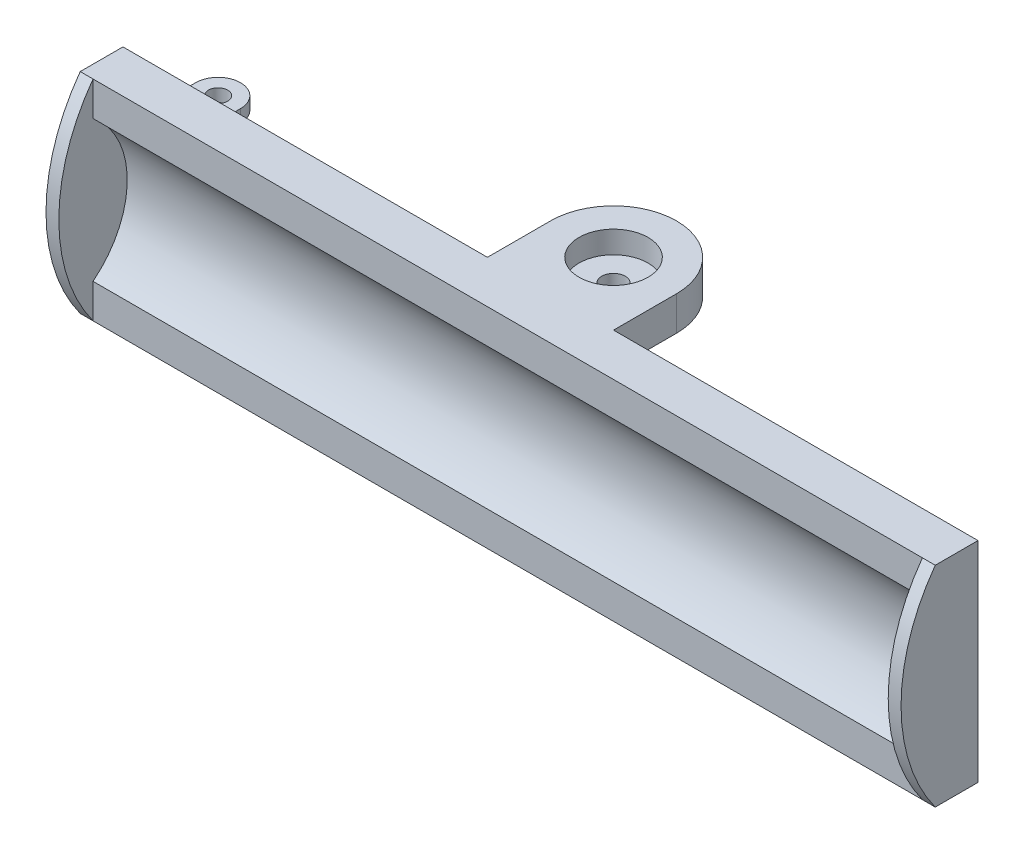
from build123d import *

# Parameters (mm, degrees)
BOSS_EXTRUDE1_DEPTH = 100
SKETCH3_R           = 2.75
BOSS_EXTRUDE2_DEPTH = 8
SKETCH4_R           = 8.075
CUT_EXTRUDE1_DEPTH  = 5.2
BOSS_EXTRUDE5_START = 8
BOSS_EXTRUDE5_DEPTH = 3
BOSS_EXTRUDE6_DEPTH = 3


with BuildPart() as part:
    # Sketch1 → Boss-Extrude1 (new, symmetric)
    with BuildSketch(Plane.YZ):
        with BuildLine():
            Line((-24.5, 5), (-24.5, -5))
            Line((-24.5, -5), (24.5, -5))
            Line((24.5, -5), (24.5, 5))
            Line((24.5, 5), (16.492422502, 5))
            ThreePointArc((16.492422502, 5), (0, -3), (-16.492422502, 5))
            Line((-16.492422502, 5), (-24.5, 5))
        make_face()
    extrude(amount=BOSS_EXTRUDE1_DEPTH, both=True)

    # Sketch3 → Boss-Extrude2 (add)
    with BuildSketch(Plane.XZ.offset(24.5)):
        with BuildLine():
            ThreePointArc((-14.75, -19.75), (0, -34.5), (14.75, -19.75))
            Line((14.75, -19.75), (14.75, -5))
            Line((14.75, -5), (-14.75, -5))
            Line((-14.75, -5), (-14.75, -19.75))
        make_face()
        with Locations((0, -19.75)):
            Circle(SKETCH3_R, mode=Mode.SUBTRACT)
    boss_extrude2 = extrude(amount=-BOSS_EXTRUDE2_DEPTH)

    # Sketch4 → Cut-Extrude1 (cut)
    with BuildSketch(Plane(origin=(0, -24.5, 0), x_dir=(-1, 0, 0), z_dir=(0, -1, 0))):
        with Locations((0, 19.75)):
            Circle(SKETCH4_R)
    cut_extrude1 = extrude(amount=-CUT_EXTRUDE1_DEPTH, mode=Mode.SUBTRACT)

    # Mirror1: Boss-Extrude2, Cut-Extrude1 across plane
    add(boss_extrude2.mirror(Plane(origin=(0, 0, 0), x_dir=(0, 0, 1), z_dir=(0, -1, 0))))
    add(cut_extrude1.mirror(Plane(origin=(0, 0, 0), x_dir=(0, 0, 1), z_dir=(0, -1, 0))), mode=Mode.SUBTRACT)

    # Sketch6 → Boss-Extrude5 (add)
    with BuildSketch(Plane(origin=(0, 0, 0), x_dir=(-1, 0, 0), z_dir=(0, -1, 0)).offset(BOSS_EXTRUDE5_START)):
        with BuildLine():
            ThreePointArc((97.75, 19.75), (92.5, 25), (87.25, 19.75))
            Line((87.25, 19.75), (87.25, 5))
            Line((87.25, 5), (97.75, 5))
            Line((97.75, 5), (97.75, 19.75))
        make_face()
        with BuildLine():
            ThreePointArc((94.75, 19.75), (92.5, 17.5), (90.25, 19.75))
            ThreePointArc((90.25, 19.75), (92.5, 22), (94.75, 19.75))
        make_face(mode=Mode.SUBTRACT)
    boss_extrude5 = extrude(amount=BOSS_EXTRUDE5_DEPTH)

    # Mirror2: Boss-Extrude5 across plane
    add(boss_extrude5.mirror(Plane(origin=(0, 0, 0), x_dir=(0, 0, 1), z_dir=(0, -1, 0))))

    # Sketch7 → Boss-Extrude6 (add)
    with BuildSketch(Plane(origin=(-100, 0, 0), x_dir=(0, -1, 0), z_dir=(-1, 0, 0))):
        with BuildLine():
            ThreePointArc((24.5, 5), (0, 13), (-24.5, 5))
            Line((-24.5, 5), (-24.5, -5))
            Line((-24.5, -5), (24.5, -5))
            Line((24.5, -5), (24.5, 5))
        make_face()
    boss_extrude6 = extrude(amount=-BOSS_EXTRUDE6_DEPTH)

    # Mirror3: Boss-Extrude6 across plane
    add(boss_extrude6.mirror(Plane(origin=(0, 0, 0), x_dir=(0, 0, 1), z_dir=(1, 0, 0))))


solid = part.part
